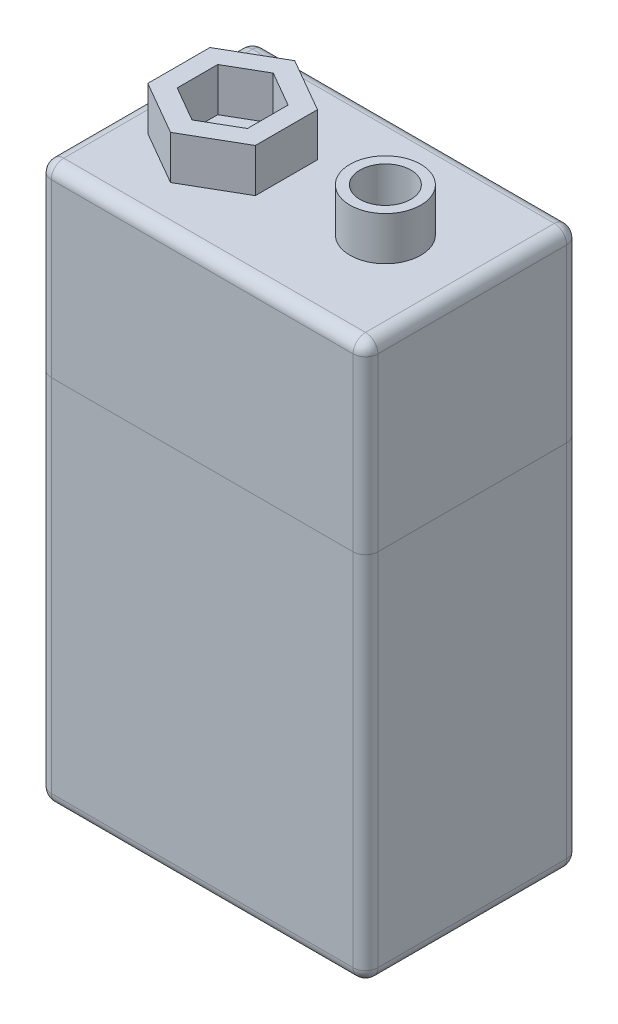
from build123d import *

# Parameters (mm, degrees)
CROQUIS1_W                = 26.3
CROQUIS1_H                = 44.8
SALIENTE_EXTRUIR1_DEPTH   = 17.2
REDONDEO1_R               = 1
CROQUIS3_R                = 2.85
CROQUIS3_R_2              = 2.05
SALIENTE_EXTRUIR2_DEPTH   = 3.5
SALIENTE_EXTRUIR2_2_DEPTH = 3.5


with BuildPart() as part:
    # Croquis1 → Saliente-Extruir1 (new body)
    with BuildSketch(Plane.XY):
        Rectangle(CROQUIS1_W, CROQUIS1_H)
    extrude(amount=SALIENTE_EXTRUIR1_DEPTH)

    # Redondeo1
    redondeo1_edges = [part.edges().sort_by_distance(p)[0] for p in [
        (13.15, -22.4, 8.6),
        (0, -22.4, 0),
        (-13.15, -22.4, 8.6),
        (0, -22.4, 17.2),
        (0, 22.4, 0),
        (-13.15, 22.4, 8.6),
        (0, 22.4, 17.2),
        (13.15, 22.4, 8.6),
        (-13.15, 0, 0),
        (13.15, 0, 0),
        (13.15, 0, 17.2),
        (-13.15, 0, 17.2),
    ]]
    fillet(redondeo1_edges, radius=REDONDEO1_R)


with BuildPart() as body_2:
    # Croquis3 → Saliente-Extruir2 (new body)
    with BuildSketch(Plane(origin=(0, 22.4, 0), x_dir=(1, 0, 0), z_dir=(0, 1, 0))):
        with Locations((6.15, -8.6)):
            Circle(CROQUIS3_R)
        with Locations((6.15, -8.6)):
            Circle(CROQUIS3_R_2, mode=Mode.SUBTRACT)
    extrude(amount=SALIENTE_EXTRUIR2_DEPTH)


with BuildPart() as body_3:
    # Croquis3 → Saliente-Extruir2 2 (new body)
    with BuildSketch(Plane(origin=(0, 22.4, 0), x_dir=(1, 0, 0), z_dir=(0, 1, 0))):
        Polygon((-1.819872981, -11.1), (-1.819872981, -6.1), (-6.15, -3.6), (-10.480127019, -6.1), (-10.480127019, -11.1), (-6.15, -13.6), align=None)
        Polygon((-3.319872981, -6.966025404), (-6.15, -5.332050808), (-8.980127019, -6.966025404), (-8.980127019, -10.233974596), (-6.15, -11.867949192), (-3.319872981, -10.233974596), align=None, mode=Mode.SUBTRACT)
    extrude(amount=SALIENTE_EXTRUIR2_2_DEPTH)


solid = Compound([part.part, body_2.part, body_3.part])
